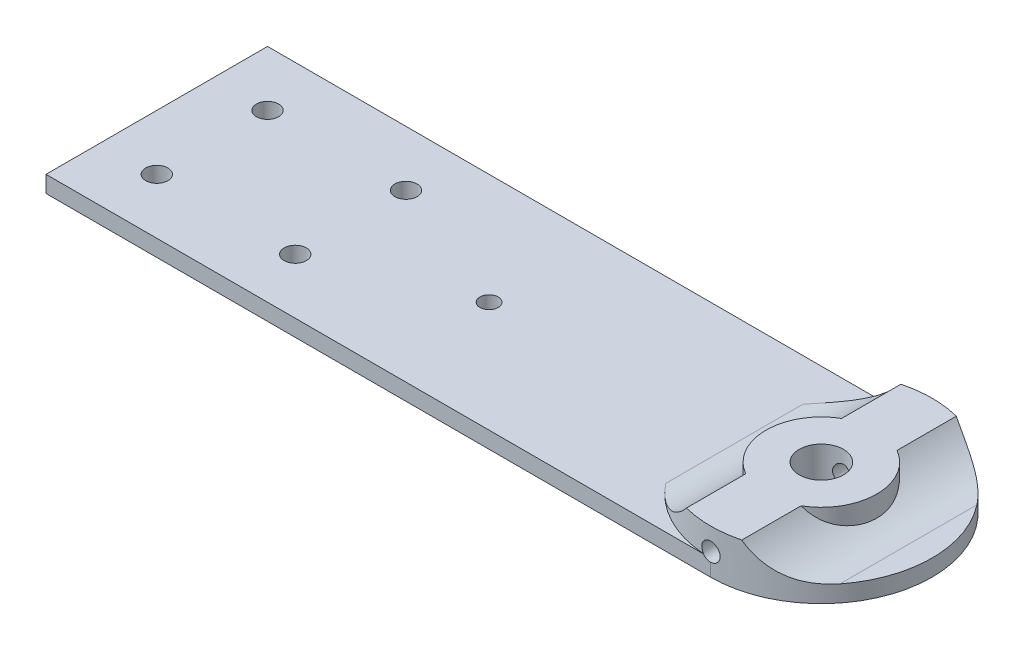
from build123d import *

# Parameters (mm, degrees)
SKETCH1_R           = 2
SKETCH1_R_2         = 4
BOSS_EXTRUDE1_DEPTH = 8
CUT_EXTRUDE1_START  = -5
SKETCH4_R           = 2
CUT_EXTRUDE1_DEPTH  = 5
FILLET2_R           = 14
M4_TAPPED_HOLE1_D   = 3.3
SKETCH5_R           = 1.65
CUT_EXTRUDE2_DEPTH  = 122.757956639
CUT_EXTRUDE3_START  = -5
CUT_EXTRUDE3_DEPTH  = 5


with BuildPart() as part:
    # Sketch1 → Boss-Extrude1 (new body)
    with BuildSketch(Plane(origin=(0, 0, 0), x_dir=(1, 0, 0), z_dir=(0, 1, 0))):
        with BuildLine():
            Line((0, 20), (-120, 20))
            Line((-120, 20), (-120, -5))
            Line((-120, -5), (-120, -20))
            Line((-120, -20), (0, -20))
            ThreePointArc((0, -20), (14.142135607, -14.14213564), (20, -4.7e-08))
            ThreePointArc((20, -4.7e-08), (14.14213564, 14.142135607), (0, 20))
        make_face()
        with Locations(Location((-110, -10, 0), (0, 0, 270))):
            Circle(SKETCH1_R, mode=Mode.SUBTRACT)
        with Locations(Location((-85, -10, 0), (0, 0, 270))):
            Circle(SKETCH1_R, mode=Mode.SUBTRACT)
        with Locations(Location((-110, 10, 0), (0, 0, 270))):
            Circle(SKETCH1_R, mode=Mode.SUBTRACT)
        with Locations(Location((-85, 10, 0), (0, 0, 270))):
            Circle(SKETCH1_R, mode=Mode.SUBTRACT)
        with Locations(Location((0, 0, 0), (0, 0, 270))):
            Circle(SKETCH1_R_2, mode=Mode.SUBTRACT)
    extrude(amount=BOSS_EXTRUDE1_DEPTH)

    # Sketch4 → Cut-Extrude1 (cut)
    # profile 1 of 2: a face of its own
    with BuildSketch(Plane(origin=(0, 8, 0), x_dir=(1, 0, 0), z_dir=(0, 1, 0)).offset(CUT_EXTRUDE1_START)):
        with BuildLine():
            Line((-5, 8.660254038), (-5, 20))
            Line((-5, 20), (-120, 20))
            Line((-120, 20), (-120, -20))
            Line((-120, -20), (-5, -20))
            Line((-5, -20), (-5, -8.660254038))
            ThreePointArc((-5, -8.660254038), (-10, 0), (-5, 8.660254038))
        make_face()
        with Locations(Location((-110, -10, 0), (0, 0, 270))):
            Circle(SKETCH4_R, mode=Mode.SUBTRACT)
        with Locations(Location((-85, -10, 0), (0, 0, 270))):
            Circle(SKETCH4_R, mode=Mode.SUBTRACT)
        with Locations(Location((-110, 10, 0), (0, 0, 270))):
            Circle(SKETCH4_R, mode=Mode.SUBTRACT)
        with Locations(Location((-85, 10, 0), (0, 0, 270))):
            Circle(SKETCH4_R, mode=Mode.SUBTRACT)
    # profile 2 of 2: a face of its own
    with BuildSketch(Plane(origin=(0, 8, 0), x_dir=(1, 0, 0), z_dir=(0, 1, 0)).offset(CUT_EXTRUDE1_START)):
        with BuildLine():
            ThreePointArc((5, -19.364916731), (20, 0), (5, 19.364916731))
            Line((5, 19.364916731), (5, 8.660254038))
            ThreePointArc((5, 8.660254038), (10, 0), (5, -8.660254038))
            Line((5, -8.660254038), (5, -19.364916731))
        make_face()
    extrude(amount=CUT_EXTRUDE1_DEPTH, mode=Mode.SUBTRACT)

    # Fillet2
    # the kernel refuses this fillet: 14 mm, written as the material it adds along each edge
    with BuildSketch(Plane(origin=(-5, 3, 20), x_dir=(-1, 0, 0), z_dir=(0, 0, -1)), Plane(origin=(-5, 3, 18.149259199), x_dir=(-1, 0, 0), z_dir=(0, 0, -1))) as fillet2_piece_1:
        with BuildLine():
            CenterArc((10.723805295, 14), FILLET2_R, 220.005200885, 49.994799115)
            Line((0, 5), (0, 0))
            Line((0, 0), (10.723805295, 0))
        make_face()
    extrude(amount=38.149259199)
    with BuildSketch(Plane(origin=(5, 3, -46.174429968), x_dir=(0, 1, 0), z_dir=(0, 0, 1))) as fillet2_piece_2_section:
        with BuildLine():
            CenterArc((14, -10.723805295), FILLET2_R, 130.005200885, 49.994799115)
            Line((0, -10.723805295), (0, 0))
            Line((0, 0), (5, 0))
        make_face()
    fillet2_piece_2 = extrude(amount=64.323689167, mode=Mode.PRIVATE)
    fillet2_piece_2 = fillet2_piece_2 & Plane(origin=(0, 3, 0), x_dir=(0, 0, 1), z_dir=(0, -1, 0)) * Cylinder(20, 172, mode=Mode.PRIVATE)
    add(fillet2_piece_2)
    with BuildSketch(Plane(origin=(5, 3, -18.149259199), x_dir=(0, 1, 0), z_dir=(0, 0, 1))) as fillet2_piece_3_section:
        with BuildLine():
            CenterArc((14, -10.723805295), FILLET2_R, 130.005200885, 49.994799115)
            Line((0, -10.723805295), (0, 0))
            Line((0, 0), (5, 0))
        make_face()
    fillet2_piece_3 = extrude(amount=64.323689167, mode=Mode.PRIVATE)
    fillet2_piece_3 = fillet2_piece_3 & Plane(origin=(0, 3, 0), x_dir=(0, 0, 1), z_dir=(0, -1, 0)) * Cylinder(20, 172, mode=Mode.PRIVATE)
    add(fillet2_piece_3)

    # M4 Tapped Hole1 (through all)
    with Locations(Plane(origin=(0, 0, -20), x_dir=(-1, 0, 0), z_dir=(0, 0, -1))):
        with Locations((0, 4)):
            Hole(M4_TAPPED_HOLE1_D / 2)

    # Sketch5 → Cut-Extrude2 (cut, through all)
    with BuildSketch(Plane(origin=(0, 3, 0), x_dir=(1, 0, 0), z_dir=(0, 1, 0))):
        with Locations(Location((-60, 0, 0), (0, 0, 270))):
            Circle(SKETCH5_R)
    extrude(amount=-CUT_EXTRUDE2_DEPTH, mode=Mode.SUBTRACT)

    # Sketch6 → Cut-Extrude3 (cut)
    with BuildSketch(Plane(origin=(0, 8, 0), x_dir=(1, 0, 0), z_dir=(0, 1, 0)).offset(CUT_EXTRUDE3_START)):
        with BuildLine():
            Line((-120, -20), (0, -20))
            ThreePointArc((0, -20), (-20, 0), (0, 20))
            Line((0, 20), (-120, 20))
            Line((-120, 20), (-120, -20))
        make_face()
    extrude(amount=CUT_EXTRUDE3_DEPTH, mode=Mode.SUBTRACT)


solid = part.part
